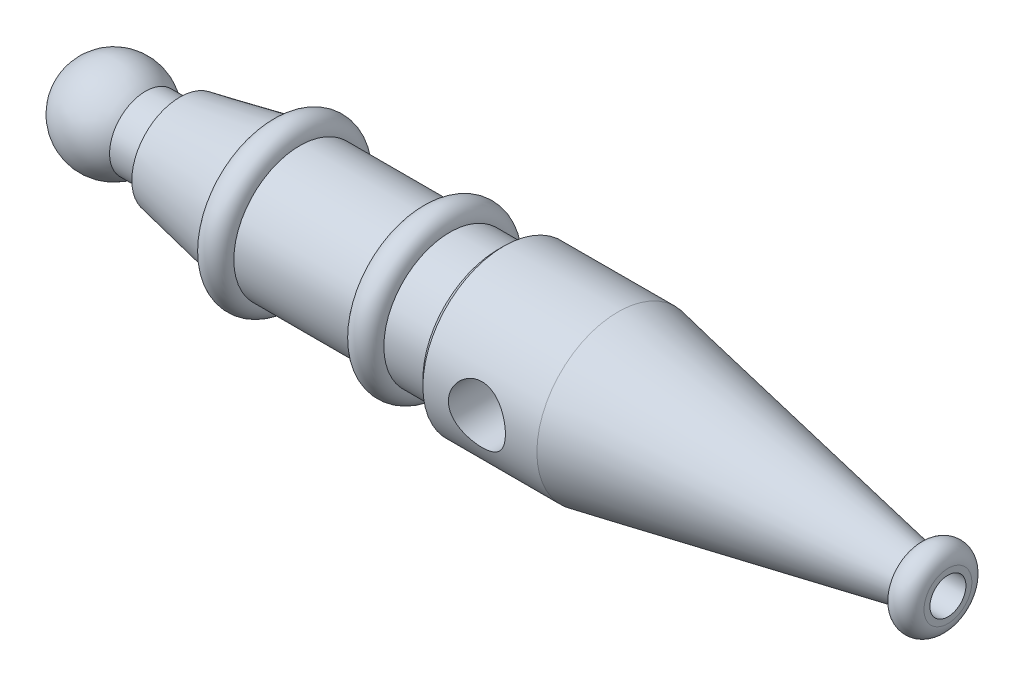
from build123d import *

# Parameters (mm, degrees)
CHAMFER1_SIZE      = 1
SKETCH3_R          = 4.75
CUT_EXTRUDE1_DEPTH = 20


with BuildPart() as part:
    # Sketch1 → Revolve1 (revolve)
    with BuildSketch(Plane.XY):
        with BuildLine():
            Line((-91.855737705, 0), (5.144262295, 0))
            Line((5.144262295, 0), (5.144262295, 3))
            Line((5.144262295, 3), (55.144262295, 3))
            Line((55.144262295, 3), (55.144262295, 3.985209508))
            ThreePointArc((55.144262295, 3.985209508), (52.644262295, 6.485209508), (50.144262295, 3.985209508))
            Line((50.144262295, 3.985209508), (0.144262295, 13.5))
            Line((0.144262295, 13.5), (-19.855737705, 13.5))
            Line((-19.855737705, 13.5), (-19.855737705, 11))
            Line((-19.855737705, 11), (-27.855737705, 11))
            ThreePointArc((-27.855737705, 11), (-30.355737705, 13.5), (-32.855737705, 11))
            Line((-32.855737705, 11), (-52.855737705, 11))
            ThreePointArc((-52.855737705, 11), (-55.355737705, 13.5), (-57.855737705, 11))
            Line((-57.855737705, 11), (-72.855737705, 8))
            Line((-72.855737705, 8), (-72.855737705, 6))
            Line((-72.855737705, 6), (-78.564235083, 6))
            ThreePointArc((-78.564235083, 6), (-87.147240327, 7.291502622), (-91.855737705, 0))
        make_face()
    revolve(axis=Axis((-1091.855737705, 0, 0), (1, 0, 0)))

    # Chamfer1
    chamfer1_edges = [part.edges().sort_by_distance(p)[0] for p in [
        (-19.855737705, -13.5, 0),
    ]]
    chamfer(chamfer1_edges, length=CHAMFER1_SIZE)

    # Sketch3 → Cut-Extrude1 (cut, symmetric)
    with BuildSketch(Plane.XY):
        with Locations((-9.855737705, 0)):
            Circle(SKETCH3_R)
    extrude(amount=CUT_EXTRUDE1_DEPTH, both=True, mode=Mode.SUBTRACT)


solid = part.part
